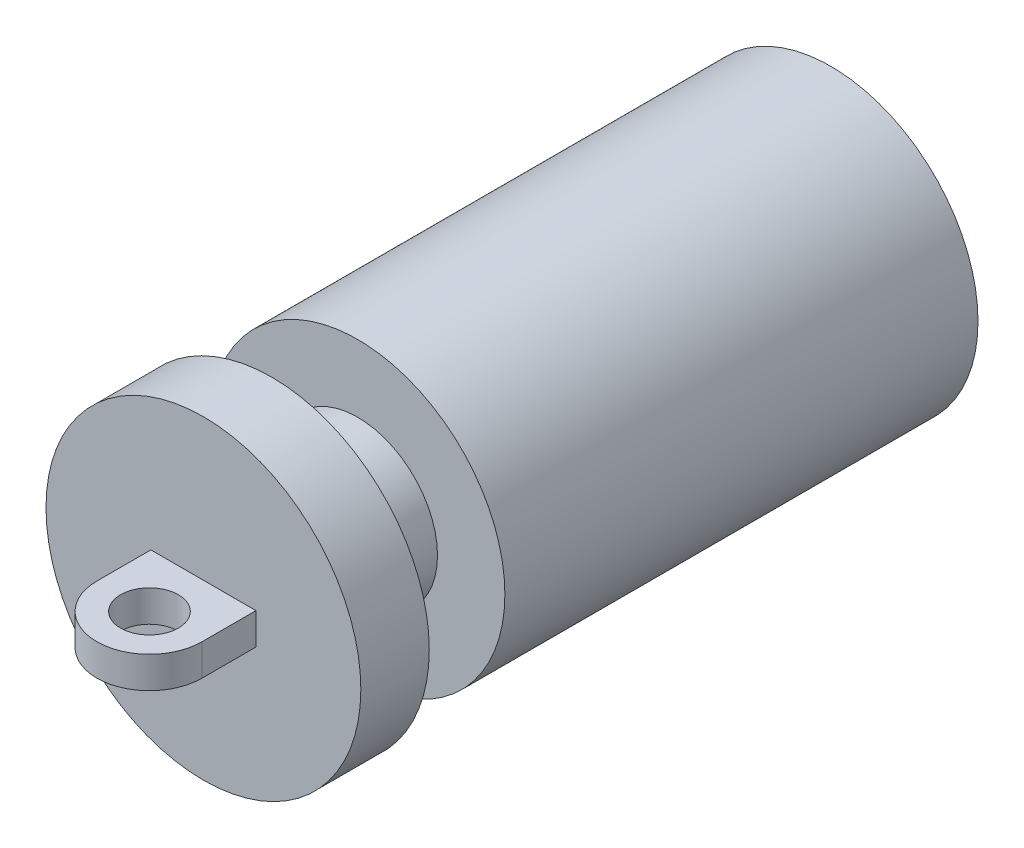
from build123d import *

# Parameters (mm, degrees)
SKETCH4_R           = 2.75
BOSS_EXTRUDE1_DEPTH = 1.5
SKETCH5_R           = 14
BOSS_EXTRUDE2_DEPTH = 45


with BuildPart() as part:
    # Sketch3 → Revolve2 (revolve)
    with BuildSketch(Plane(origin=(0, 0, 0), x_dir=(0, 0, -1), z_dir=(1, 0, 0))):
        Polygon((-4.082352568, 7.591974679), (4.082352568, 7.591974679), (4.082352568, 0), (-10.590979782, 0), (-10.590979782, 14.972833613), (-4.082352568, 14.972833613), align=None)
    revolve(axis=Axis((0, 0, 16.393474527), (0, 0, -1)))

    # Sketch4 → Boss-Extrude1 (add, symmetric)
    with BuildSketch(Plane(origin=(0, 0, 0), x_dir=(1, 0, 0), z_dir=(0, 1, 0))):
        with BuildLine():
            Line((-5, -15.723809824), (-5, -10.590979782))
            Line((-5, -10.590979782), (5, -10.590979782))
            Line((5, -10.590979782), (5, -15.723809824))
            ThreePointArc((5, -15.723809824), (0, -20.723809824), (-5, -15.723809824))
        make_face()
        with Locations((0, -15.723809824)):
            Circle(SKETCH4_R, mode=Mode.SUBTRACT)
    extrude(amount=BOSS_EXTRUDE1_DEPTH, both=True)

    # Sketch5 → Boss-Extrude2 (add)
    with BuildSketch(Plane(origin=(0, 0, -4.082352568), x_dir=(-1, 0, 0), z_dir=(0, 0, -1))):
        Circle(SKETCH5_R)
    extrude(amount=BOSS_EXTRUDE2_DEPTH)


solid = part.part
